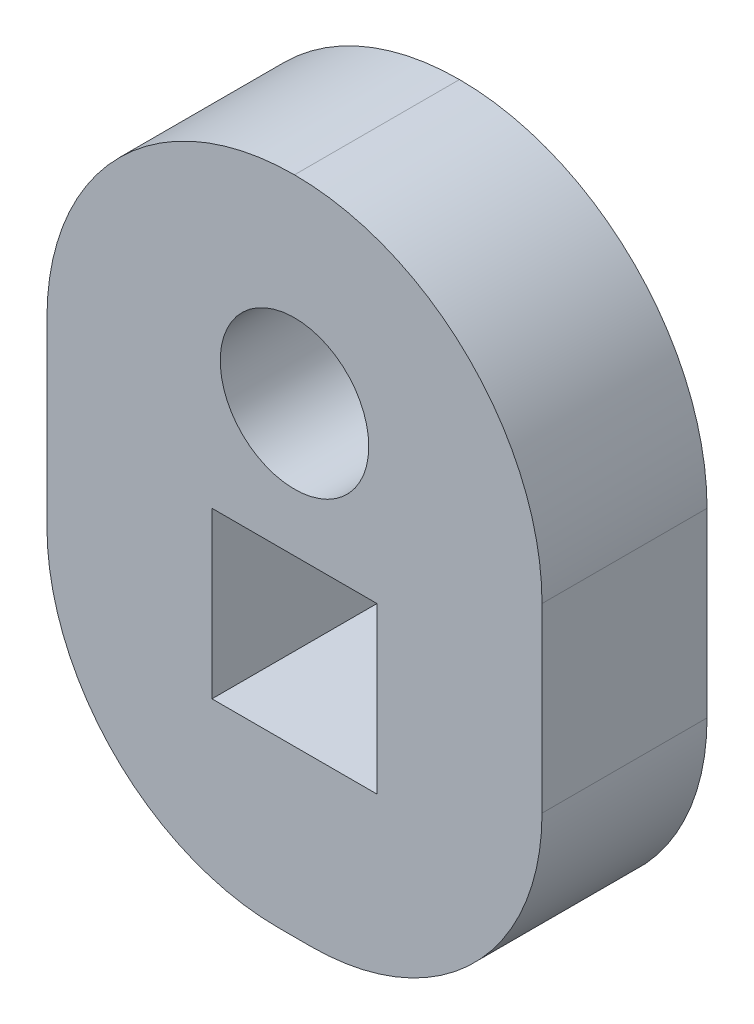
from build123d import *

# Parameters (mm, degrees)
ESQUISSE1_W             = 15
ESQUISSE1_H             = 20
BOSS_EXTRU_1_DEPTH      = 5
ESQUISSE2_W             = 5
ESQUISSE2_H             = 5
ESQUISSE2_R             = 2.25
ENL_V_MAT_EXTRU_1_DEPTH = 5
CONG_1_R                = 7.5
CONG_4_R                = 7.5
CONG_5_R                = 7


with BuildPart() as part:
    # Esquisse1 → Boss.-Extru.1 (new body)
    with BuildSketch(Plane.XY):
        with Locations((-45.477663375, -34.327294686)):
            Rectangle(ESQUISSE1_W, ESQUISSE1_H)
    extrude(amount=BOSS_EXTRU_1_DEPTH)

    # Esquisse2 → Enlèv. mat.-Extru.1 (cut)
    with BuildSketch(Plane.XY.offset(5)):
        with Locations((-45.477663375, -36.827294686)):
            Rectangle(ESQUISSE2_W, ESQUISSE2_H)
        with Locations((-45.477663375, -30.327294686)):
            Circle(ESQUISSE2_R)
    extrude(amount=-ENL_V_MAT_EXTRU_1_DEPTH, mode=Mode.SUBTRACT)

    # Congé1
    cong_1_edges = [part.edges().sort_by_distance(p)[0] for p in [
        (-52.977663375, -24.327294686, 2.5),
    ]]
    fillet(cong_1_edges, radius=CONG_1_R)

    # Congé4
    cong_4_edges = [part.edges().sort_by_distance(p)[0] for p in [
        (-37.977663375, -24.327294686, 2.5),
    ]]
    fillet(cong_4_edges, radius=CONG_4_R - 0.0001)  # a hair under: the kernel refuses the full size

    # Congé5
    cong_5_edges = [part.edges().sort_by_distance(p)[0] for p in [
        (-37.977663375, -44.327294686, 2.5),
        (-52.977663375, -44.327294686, 2.5),
    ]]
    fillet(cong_5_edges, radius=CONG_5_R)


solid = part.part
